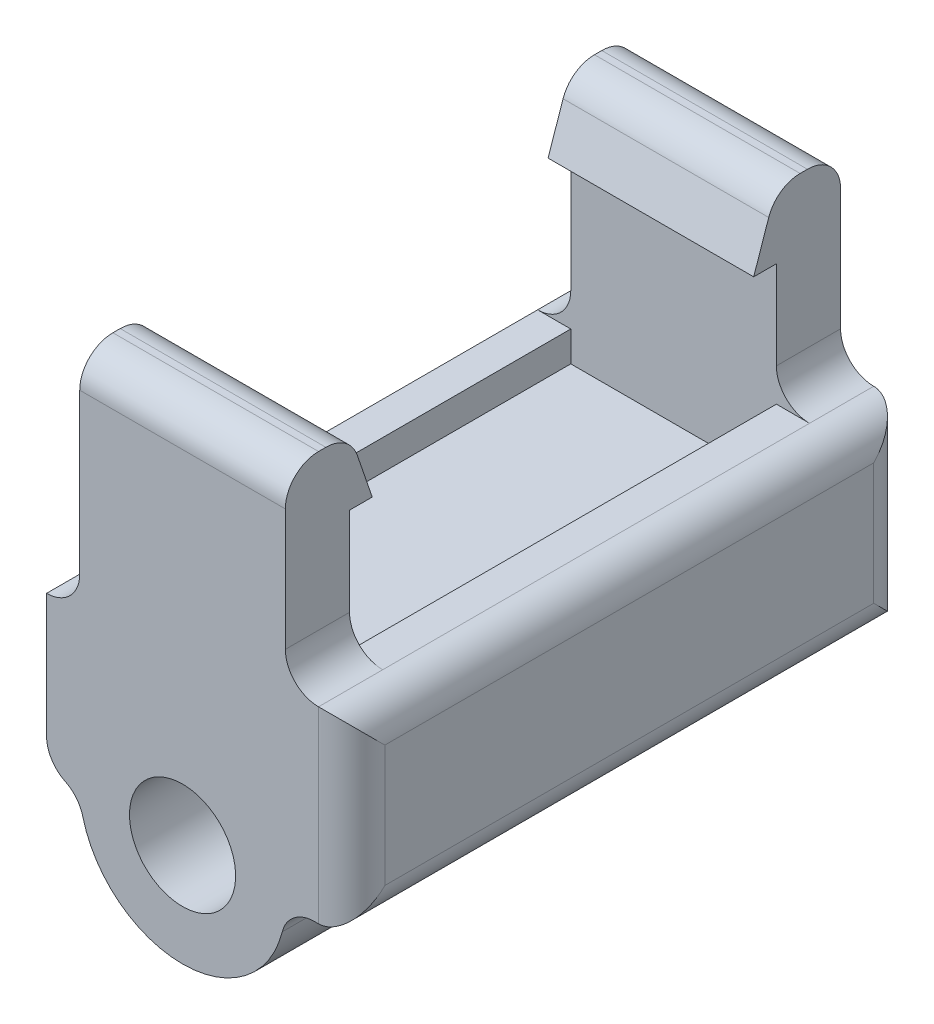
from build123d import *

# Parameters (mm, degrees)
ESBO_O1_R                = 3.1
ESBO_O1_R_2              = 1.55
RESSALTO_EXTRUS_O1_DEPTH = 16.74
BOSS_EXTRUDE1_DEPTH      = 16.74
SKETCH2_W                = 6.2
SKETCH2_H                = 1.935
BOSS_EXTRUDE2_DEPTH      = 7.715
BOSS_EXTRUDE3_DEPTH      = 6.2
SKETCH5_W                = 16.74
SKETCH5_H                = 5.66650546
BOSS_EXTRUDE4_DEPTH      = 2
SKETCH6_W                = 16.74
SKETCH6_H                = 4.529470895
BOSS_EXTRUDE5_DEPTH      = 1
FILLET1_R                = 1
FILLET4_R                = 1
M3_CLEARANCE_HOLE1_D     = 3.2


with BuildPart() as part:
    # Esboço1 → Ressalto-extrusão1 (new body)
    with BuildSketch(Plane.XY):
        with Locations((16.016666667, 16.016666667)):
            Circle(ESBO_O1_R)
        with Locations((16.016666667, 16.016666667)):
            Circle(ESBO_O1_R_2, mode=Mode.SUBTRACT)
    extrude(amount=RESSALTO_EXTRUS_O1_DEPTH)

    # Sketch1 → Boss-Extrude1 (add)
    with BuildSketch(Plane(origin=(0, 0, 0), x_dir=(-1, 0, 0), z_dir=(0, 0, -1))):
        with BuildLine():
            Line((-12.916666667, 16.016666667), (-12.916666667, 19.634677588))
            Line((-12.916666667, 19.634677588), (-19.116666667, 19.634677588))
            Line((-19.116666667, 19.634677588), (-19.116666667, 16.016666667))
            ThreePointArc((-19.116666667, 16.016666667), (-16.016666667, 19.116666667), (-12.916666667, 16.016666667))
        make_face()
    extrude(amount=-BOSS_EXTRUDE1_DEPTH)

    # Sketch2 → Boss-Extrude2 (add)
    with BuildSketch(Plane(origin=(0, 19.634677588, 0), x_dir=(1, 0, 0), z_dir=(0, 1, 0))):
        with Locations((16.016666667, -0.9675)):
            Rectangle(SKETCH2_W, SKETCH2_H)
        with Locations((16.016666667, -15.7725)):
            Rectangle(SKETCH2_W, SKETCH2_H)
    extrude(amount=BOSS_EXTRUDE2_DEPTH)

    # Sketch4 → Boss-Extrude3 (add)
    with BuildSketch(Plane.ZY.offset(-12.916666667)):
        Polygon((1.935, 27.349677588), (1.935, 25.349677588), (2.619300497, 25.349677588), align=None)
        Polygon((14.120699503, 25.349677588), (14.805, 27.349677588), (14.805, 25.349677588), align=None)
    extrude(amount=-BOSS_EXTRUDE3_DEPTH)

    # Sketch5 → Boss-Extrude4 (add)
    with BuildSketch(Plane(origin=(19.116666667, 0, 0), x_dir=(0, 0, -1), z_dir=(1, 0, 0))):
        with Locations((-8.37, 18.849919397)):
            Rectangle(SKETCH5_W, SKETCH5_H)
    extrude(amount=BOSS_EXTRUDE4_DEPTH)

    # Sketch6 → Boss-Extrude5 (add)
    with BuildSketch(Plane.ZY.offset(-12.916666667)):
        with Locations((8.37, 18.281402115)):
            Rectangle(SKETCH6_W, SKETCH6_H)
    extrude(amount=BOSS_EXTRUDE5_DEPTH)

    # Fillet1
    fillet1_edges = [part.edges().sort_by_distance(p)[0] for p in [
        (21.116666667, 21.683172127, 8.37),
        (21.116666667, 18.849919397, 0),
        (21.116666667, 16.016666667, 8.37),
        (21.116666667, 18.849919397, 16.74),
        (16.016666667, 27.349677588, 0),
        (16.016666667, 27.349677588, 1.935),
        (16.016666667, 27.349677588, 16.74),
        (16.016666667, 27.349677588, 14.805),
        (19.116666667, 21.683172127, 15.7725),
        (12.916666667, 20.546137562, 15.7725),
        (12.916666667, 20.546137562, 0.9675),
        (19.116666667, 21.683172127, 0.9675),
        (12.916666667, 16.016666667, 8.37),
        (19.116666667, 16.016666667, 8.37),
    ]]
    fillet(fillet1_edges, radius=FILLET1_R - 0.0001)  # a hair under: the kernel refuses the full size

    # Fillet4
    fillet4_edges = [part.edges().sort_by_distance(p)[0] for p in [
        (11.916666667, 16.016666667, 8.37),
    ]]
    fillet(fillet4_edges, radius=FILLET4_R)

    # M3 Clearance Hole1 (through all)
    with Locations(Plane(origin=(0, 0, 0), x_dir=(-1, 0, 0), z_dir=(0, 0, -1))):
        with Locations((-16.016666667, 16.016666667)):
            Hole(M3_CLEARANCE_HOLE1_D / 2)


solid = part.part
